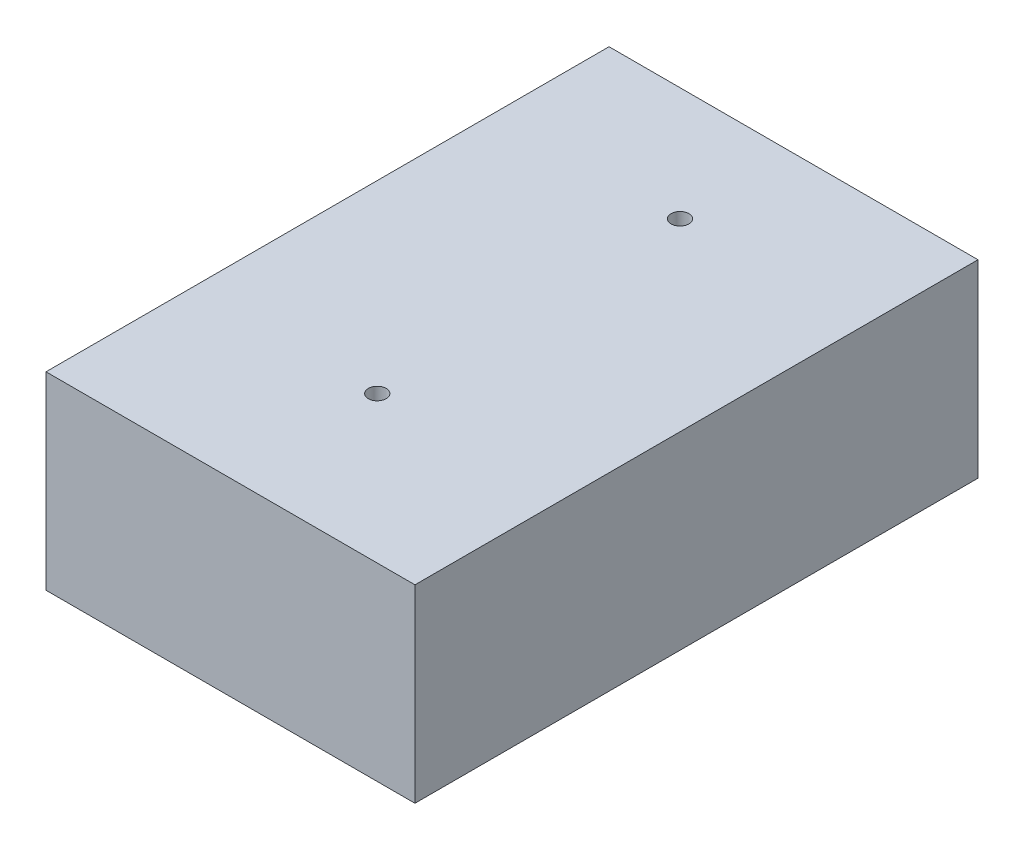
from build123d import *

# Parameters (mm, degrees)
SKETCH1_W           = 61.9125
SKETCH1_H           = 94.479888928
BOSS_EXTRUDE1_DEPTH = 31.75
SKETCH2_R           = 1.5
CUT_EXTRUDE1_DEPTH  = 2.54


with BuildPart() as part:
    # Sketch1 → Boss-Extrude1 (new body)
    with BuildSketch(Plane(origin=(0, 0, 0), x_dir=(1, 0, 0), z_dir=(0, 1, 0))):
        Rectangle(SKETCH1_W, SKETCH1_H)
    extrude(amount=BOSS_EXTRUDE1_DEPTH)

    # Sketch2 → Cut-Extrude1 (cut)
    with BuildSketch(Plane(origin=(0, 31.75, 0), x_dir=(1, 0, 0), z_dir=(0, 1, 0))):
        with Locations((0, 28.189944464)):
            Circle(SKETCH2_R)
        with Locations((0, -22.610055536)):
            Circle(SKETCH2_R)
    extrude(amount=-CUT_EXTRUDE1_DEPTH, mode=Mode.SUBTRACT)


solid = part.part
